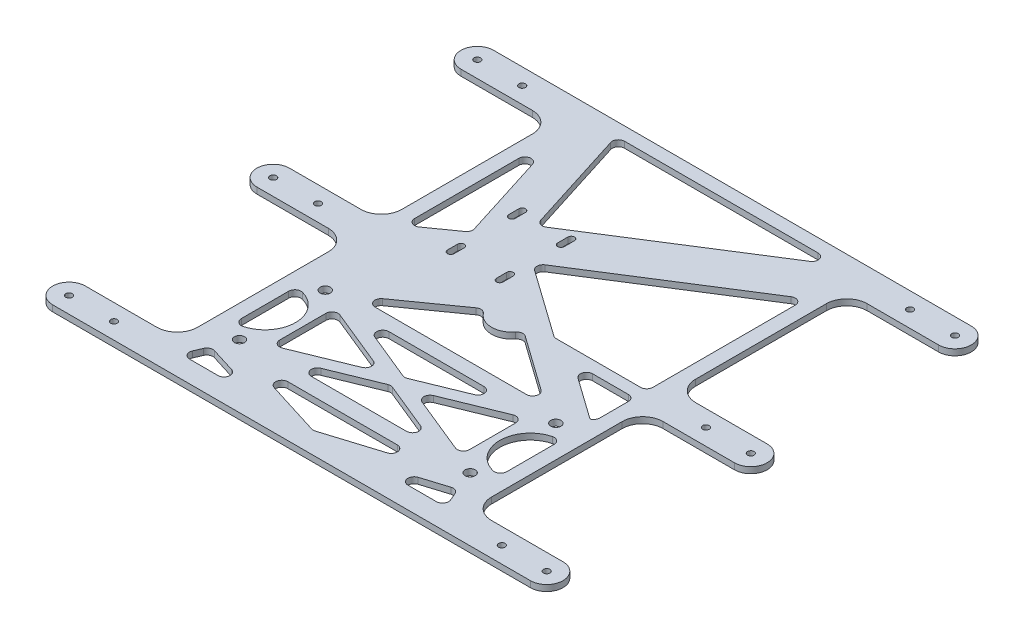
from build123d import *

# Parameters (mm, degrees)
SKETCH_1_W          = 144
SKETCH_1_H          = 16
SKETCH_1_H_2        = 84
SKETCH_1_R          = 1.6
EXTRUDE_1_DEPTH     = 3
FILLET_1_R          = 10
SKETCH_2_R          = 1.6
CUT_EXTRUDE_1_DEPTH = 166.221064032
SKETCH_4_R          = 2.5
CUT_EXTRUDE_2_DEPTH = 166.221064032
CUT_EXTRUDE_4_DEPTH = 10
SKETCH_6_R          = 10
EXTRUDE_2_DEPTH     = 3
CUT_EXTRUDE_6_DEPTH = 166.221064032
FILLET_2_R          = 3


with BuildPart() as part:
    # 草图1 → 凸台-拉伸1 (new body)
    # profile 1 of 13: a face of its own
    with BuildSketch(Plane(origin=(0, 0, 0), x_dir=(1, 0, 0), z_dir=(0, 1, 0))):
        Rectangle(SKETCH_1_W, SKETCH_1_H)
    # profile 2 of 13: a face of its own
    with BuildSketch(Plane(origin=(0, 0, 0), x_dir=(1, 0, 0), z_dir=(0, 1, 0))):
        with Locations((0, -50)):
            Rectangle(SKETCH_1_W, SKETCH_1_H_2)
    # profile 3 of 13: a face of its own
    with BuildSketch(Plane(origin=(0, 0, 0), x_dir=(1, 0, 0), z_dir=(0, 1, 0))):
        with Locations((0, 50)):
            Rectangle(SKETCH_1_W, SKETCH_1_H_2)
    # profile 4 of 13: a face of its own
    with BuildSketch(Plane(origin=(0, 0, 0), x_dir=(1, 0, 0), z_dir=(0, 1, 0))):
        with BuildLine():
            Line((-72, 8), (-95, 8))
            ThreePointArc((-95, 8), (-87, 0), (-95, -8))
            Line((-95, -8), (-72, -8))
            Line((-72, -8), (-72, 8))
        make_face()
    # profile 5 of 13: a face of its own
    with BuildSketch(Plane(origin=(0, 0, 0), x_dir=(1, 0, 0), z_dir=(0, 1, 0))):
        with BuildLine():
            Line((-117, -8), (-95, -8))
            ThreePointArc((-95, -8), (-87, 0), (-95, 8))
            Line((-95, 8), (-117, 8))
            ThreePointArc((-117, 8), (-125, 0), (-117, -8))
        make_face()
        with Locations(Location((-117, 0, 0), (0, 0, 270))):
            Circle(SKETCH_1_R, mode=Mode.SUBTRACT)
        with Locations(Location((-95, 0, 0), (0, 0, 270))):
            Circle(SKETCH_1_R, mode=Mode.SUBTRACT)
    # profile 6 of 13: a face of its own
    with BuildSketch(Plane(origin=(0, 0, 0), x_dir=(1, 0, 0), z_dir=(0, 1, 0))):
        with BuildLine():
            ThreePointArc((-95, -92), (-87, -100), (-95, -108))
            Line((-95, -108), (-117, -108))
            ThreePointArc((-117, -108), (-125, -100), (-117, -92))
            Line((-117, -92), (-95, -92))
        make_face()
        with Locations(Location((-95, -100, 0), (0, 0, 270))):
            Circle(SKETCH_1_R, mode=Mode.SUBTRACT)
        with Locations(Location((-117, -100, 0), (0, 0, 270))):
            Circle(SKETCH_1_R, mode=Mode.SUBTRACT)
    # profile 7 of 13: a face of its own
    with BuildSketch(Plane(origin=(0, 0, 0), x_dir=(1, 0, 0), z_dir=(0, 1, 0))):
        with BuildLine():
            ThreePointArc((95, -92), (87, -100), (95, -108))
            Line((95, -108), (-95, -108))
            ThreePointArc((-95, -108), (-87, -100), (-95, -92))
            Line((-95, -92), (95, -92))
        make_face()
    # profile 8 of 13: a face of its own
    with BuildSketch(Plane(origin=(0, 0, 0), x_dir=(1, 0, 0), z_dir=(0, 1, 0))):
        with BuildLine():
            Line((117, -92), (95, -92))
            ThreePointArc((95, -92), (87, -100), (95, -108))
            Line((95, -108), (117, -108))
            ThreePointArc((117, -108), (125, -100), (117, -92))
        make_face()
        with Locations(Location((117, -100, 0), (0, 0, 270))):
            Circle(SKETCH_1_R, mode=Mode.SUBTRACT)
        with Locations(Location((95, -100, 0), (0, 0, 270))):
            Circle(SKETCH_1_R, mode=Mode.SUBTRACT)
    # profile 9 of 13: a face of its own
    with BuildSketch(Plane(origin=(0, 0, 0), x_dir=(1, 0, 0), z_dir=(0, 1, 0))):
        with BuildLine():
            ThreePointArc((95, 92), (87, 100), (95, 108))
            Line((95, 108), (117, 108))
            ThreePointArc((117, 108), (125, 100), (117, 92))
            Line((117, 92), (95, 92))
        make_face()
        with Locations(Location((95, 100, 0), (0, 0, 270))):
            Circle(SKETCH_1_R, mode=Mode.SUBTRACT)
        with Locations(Location((117, 100, 0), (0, 0, 270))):
            Circle(SKETCH_1_R, mode=Mode.SUBTRACT)
    # profile 10 of 13: a face of its own
    with BuildSketch(Plane(origin=(0, 0, 0), x_dir=(1, 0, 0), z_dir=(0, 1, 0))):
        with BuildLine():
            ThreePointArc((95, -8), (87, 0), (95, 8))
            Line((95, 8), (117, 8))
            ThreePointArc((117, 8), (125, 0), (117, -8))
            Line((117, -8), (95, -8))
        make_face()
        with Locations(Location((95, 0, 0), (0, 0, 270))):
            Circle(SKETCH_1_R, mode=Mode.SUBTRACT)
        with Locations(Location((117, 0, 0), (0, 0, 270))):
            Circle(SKETCH_1_R, mode=Mode.SUBTRACT)
    # profile 11 of 13: a face of its own
    with BuildSketch(Plane(origin=(0, 0, 0), x_dir=(1, 0, 0), z_dir=(0, 1, 0))):
        with BuildLine():
            Line((95, 8), (72, 8))
            Line((72, 8), (72, -8))
            Line((72, -8), (95, -8))
            ThreePointArc((95, -8), (87, 0), (95, 8))
        make_face()
    # profile 12 of 13: a face of its own
    with BuildSketch(Plane(origin=(0, 0, 0), x_dir=(1, 0, 0), z_dir=(0, 1, 0))):
        with BuildLine():
            Line((-95, 92), (95, 92))
            ThreePointArc((95, 92), (87, 100), (95, 108))
            Line((95, 108), (-95, 108))
            ThreePointArc((-95, 108), (-87, 100), (-95, 92))
        make_face()
    # profile 13 of 13: a face of its own
    with BuildSketch(Plane(origin=(0, 0, 0), x_dir=(1, 0, 0), z_dir=(0, 1, 0))):
        with BuildLine():
            Line((-117, 92), (-95, 92))
            ThreePointArc((-95, 92), (-87, 100), (-95, 108))
            Line((-95, 108), (-117, 108))
            ThreePointArc((-117, 108), (-125, 100), (-117, 92))
        make_face()
        with Locations(Location((-117, 100, 0), (0, 0, 270))):
            Circle(SKETCH_1_R, mode=Mode.SUBTRACT)
        with Locations(Location((-95, 100, 0), (0, 0, 270))):
            Circle(SKETCH_1_R, mode=Mode.SUBTRACT)
    extrude(amount=EXTRUDE_1_DEPTH)

    # 圆角1
    fillet_1_edges = [part.edges().sort_by_distance(p)[0] for p in [
        (72, 1.5, -92),
        (72, 1.5, -8),
        (72, 1.5, 8),
        (72, 1.5, 92),
        (-72, 1.5, 92),
        (-72, 1.5, 8),
        (-72, 1.5, -8),
        (-72, 1.5, -92),
    ]]
    fillet(fillet_1_edges, radius=FILLET_1_R)

    # 草图2 → 切除-拉伸1 (cut, through all)
    with BuildSketch(Plane(origin=(0, 3, 0), x_dir=(1, 0, 0), z_dir=(0, 1, 0))):
        with BuildLine():
            ThreePointArc((-40.4, 47), (-42, 45.4), (-43.6, 47))
            Line((-43.6, 47), (-43.6, 42))
            ThreePointArc((-43.6, 42), (-42, 43.6), (-40.4, 42))
            Line((-40.4, 42), (-40.4, 47))
        make_face()
        with Locations((-42, 47)):
            Circle(SKETCH_2_R)
        with Locations((-42, 42)):
            Circle(SKETCH_2_R)
        with Locations((-18, 42)):
            Circle(SKETCH_2_R)
        with BuildLine():
            ThreePointArc((-16.4, 47), (-18, 45.4), (-19.6, 47))
            Line((-19.6, 47), (-19.6, 42))
            ThreePointArc((-19.6, 42), (-18, 43.6), (-16.4, 42))
            Line((-16.4, 42), (-16.4, 47))
        make_face()
        with Locations((-18, 47)):
            Circle(SKETCH_2_R)
        with Locations((-18, 17)):
            Circle(SKETCH_2_R)
        with BuildLine():
            ThreePointArc((-16.4, 17), (-18, 15.4), (-19.6, 17))
            Line((-19.6, 17), (-19.6, 12))
            ThreePointArc((-19.6, 12), (-18, 13.6), (-16.4, 12))
            Line((-16.4, 12), (-16.4, 17))
        make_face()
        with Locations((-18, 12)):
            Circle(SKETCH_2_R)
        with Locations((-42, 12)):
            Circle(SKETCH_2_R)
        with BuildLine():
            ThreePointArc((-40.4, 17), (-42, 15.4), (-43.6, 17))
            Line((-43.6, 17), (-43.6, 12))
            ThreePointArc((-43.6, 12), (-42, 13.6), (-40.4, 12))
            Line((-40.4, 12), (-40.4, 17))
        make_face()
        with Locations((-42, 17)):
            Circle(SKETCH_2_R)
    extrude(amount=-CUT_EXTRUDE_1_DEPTH, mode=Mode.SUBTRACT)

    # 草图4 → 切除-拉伸2 (cut, through all)
    with BuildSketch(Plane(origin=(0, 3, 0), x_dir=(1, 0, 0), z_dir=(0, 1, 0))):
        with Locations(Location((-56.5, -35, 0), (0, 0, 270))):
            Circle(SKETCH_4_R)
        with Locations(Location((56.5, -35, 0), (0, 0, 270))):
            Circle(SKETCH_4_R)
        with Locations(Location((56.5, -77, 0), (0, 0, 270))):
            Circle(SKETCH_4_R)
        with Locations(Location((-56.5, -77, 0), (0, 0, 270))):
            Circle(SKETCH_4_R)
    extrude(amount=-CUT_EXTRUDE_2_DEPTH, mode=Mode.SUBTRACT)

    # 草图5 → 切除-拉伸4 (cut)
    with BuildSketch(Plane(origin=(0, 3, 0), x_dir=(1, 0, 0), z_dir=(0, 1, 0))):
        Polygon((45, 97.5), (-45, 97.5), (-30, 50), align=None)
        Polygon((-50, 27), (-65, 74.5), (-65, 16.35483871), align=None)
        Polygon((65, 5), (65, 74.5), (-10, 27), (21, 5), align=None)
        with BuildLine():
            ThreePointArc((-65, -71), (-50, -56), (-65, -41))
            Line((-65, -41), (-65, -71))
        make_face()
        Polygon((0, 3), (-46.5, -30), (46.5, -30), align=None)
        Polygon((65, -25), (65, -5), (35.090909091, -5), (63.272727273, -25), align=None)
        Polygon((-60.545967179, -87), (-65, -97.5), (-26.873553386, -97.5), align=None)
        Polygon((-7.931362411, -56), (-46.5, -40.240771738), (-46.5, -71.759228262), align=None)
        Polygon((38.568637589, -37), (-38.568637589, -37), (0, -52.759228262), align=None)
        Polygon((46.5, -71.759228262), (46.5, -40.240771738), (7.931362411, -56), align=None)
        with BuildLine():
            Line((65, -71), (65, -41))
            ThreePointArc((65, -41), (50, -56), (65, -71))
        make_face()
        Polygon((-46.5, -83), (0, -97.5), (46.5, -83), align=None)
        Polygon((38.568637589, -75), (0, -59.240771738), (-38.568637589, -75), align=None)
        Polygon((60.545967179, -87), (26.873553386, -97.5), (65, -97.5), align=None)
    extrude(amount=-CUT_EXTRUDE_4_DEPTH, mode=Mode.SUBTRACT)

    # 草图6 → 凸台-拉伸2 (add, through all)
    with BuildSketch(Plane(origin=(0, 3, 0), x_dir=(1, 0, 0), z_dir=(0, 1, 0))):
        Circle(SKETCH_6_R)
    extrude(amount=-EXTRUDE_2_DEPTH)

    # 草图8 → 切除-拉伸6 (cut, through all)
    # profile 1 of 3: a face of its own
    with BuildSketch(Plane(origin=(0, 3, 0), x_dir=(1, 0, 0), z_dir=(0, 1, 0))):
        Polygon((-65, 16.35483871), (-65, 11.449915404), (-45.307908139, 25.424948338), (-65, 87.78323923), (-65, 74.5), (-50, 27), align=None)
    # profile 2 of 3: a face of its own
    with BuildSketch(Plane(origin=(0, 3, 0), x_dir=(1, 0, 0), z_dir=(0, 1, 0))):
        Polygon((58.791697223, 101.5), (-50.45786502, 101.5), (-32.249604646, 43.840508816), align=None)
        Polygon((45, 97.5), (-30, 50), (-45, 97.5), align=None, mode=Mode.SUBTRACT)
    # profile 3 of 3: a face of its own
    with BuildSketch(Plane(origin=(0, 3, 0), x_dir=(1, 0, 0), z_dir=(0, 1, 0))):
        Polygon((-17.177652793, 27.188894806), (19.724880797, 1), (65, 1), (65, 5), (21, 5), (-10, 27), (65, 74.5), (65, 79.234741575), align=None)
    extrude(amount=-CUT_EXTRUDE_6_DEPTH, mode=Mode.SUBTRACT)

    # 圆角2
    # the kernel refuses this fillet: 3 mm, written as the material it adds along each edge
    with BuildSketch(Plane(origin=(0, 3, 52.759228262), x_dir=(-0.9257054315077341, 0, -0.3782452300784242), z_dir=(0, -1, 0))) as fillet_2_piece_1:
        with BuildLine():
            CenterArc((FILLET_2_R * 0.408602150538, FILLET_2_R), FILLET_2_R, 225.549939098, 44.450060902)
            Line((-FILLET_2_R * 0.291685177313, FILLET_2_R * 0.286138908154), (0, 0))
            Line((0, 0), (FILLET_2_R * 0.408602150538, 0))
        make_face()
    extrude(amount=3)
    with BuildSketch(Plane(origin=(-38.568637589, 3, 37), x_dir=(0.9257054315077324, 0, 0.3782452300784281), z_dir=(0, -1, 0)), Plane(origin=(38.568637589, 3, 37), x_dir=(-1, 0, 0), z_dir=(0, -1, 0)), Plane(origin=(-38.568637589, 3, 75), x_dir=(1, 0, 0), z_dir=(0, -1, 0))) as fillet_2_piece_2:
        with BuildLine():
            CenterArc((FILLET_2_R * 5.0911558914, -FILLET_2_R), FILLET_2_R, 90, 157.774969549)
            Line((FILLET_2_R * 4.71291066132, -FILLET_2_R * 1.92570543151), (0, 0))
            Line((0, 0), (FILLET_2_R * 5.0911558914, 0))
        make_face()
    extrude(amount=3)
    with BuildSketch(Plane(origin=(-46.5, 3, 71.759228262), x_dir=(0.9257054315077324, 0, -0.37824523007842814), z_dir=(0, -1, 0)), Plane(origin=(-46.5, 3, 40.240771738), x_dir=(0, 0, 1), z_dir=(0, -1, 0)), Plane(origin=(46.5, 3, 40.240771738), x_dir=(-0.9257054315077325, 0, 0.3782452300784279), z_dir=(0, -1, 0))) as fillet_2_piece_3:
        with BuildLine():
            CenterArc((FILLET_2_R * 1.48885939649, -FILLET_2_R), FILLET_2_R, 90, 112.225030451)
            Line((FILLET_2_R * 0.563153964978, -FILLET_2_R * 1.37824523008), (0, 0))
            Line((0, 0), (FILLET_2_R * 1.48885939649, 0))
        make_face()
    extrude(amount=3)
    with BuildSketch(Plane(origin=(-7.931362411, 3, 56), x_dir=(-0.9257054315077323, 0, 0.3782452300784284), z_dir=(0, -1, 0))) as fillet_2_piece_4:
        with BuildLine():
            CenterArc((FILLET_2_R * 2.44736842105, FILLET_2_R), FILLET_2_R, 134.450060902, 135.549939098)
            Line((FILLET_2_R * 1.7470810932, FILLET_2_R * 1.71386109185), (0, 0))
            Line((0, 0), (FILLET_2_R * 2.44736842105, 0))
        make_face()
    extrude(amount=3)
    with BuildSketch(Plane(origin=(46.5, 3, 30), x_dir=(-1, 0, 0), z_dir=(0, -1, 0))) as fillet_2_piece_5:
        with BuildLine():
            CenterArc((FILLET_2_R * 3.13696161898, FILLET_2_R), FILLET_2_R, 125.362461887, 144.637538113)
            Line((FILLET_2_R * 2.55821461304, FILLET_2_R * 1.81550714474), (0, 0))
            Line((0, 0), (FILLET_2_R * 3.13696161898, 0))
        make_face()
    extrude(amount=3)
    with BuildSketch(Plane(origin=(-46.5, 3, 30), x_dir=(1, 0, 0), z_dir=(0, -1, 0)), Plane(origin=(35.090909091, 3, 5), x_dir=(0.8155071447352176, 0, 0.5787470059411219), z_dir=(0, -1, 0))) as fillet_2_piece_6:
        with BuildLine():
            CenterArc((FILLET_2_R * 3.13696161898, -FILLET_2_R), FILLET_2_R, 90, 144.637538113)
            Line((FILLET_2_R * 2.55821461304, -FILLET_2_R * 1.81550714474), (0, 0))
            Line((0, 0), (FILLET_2_R * 3.13696161898, 0))
        make_face()
    extrude(amount=3)
    with BuildSketch(Plane(origin=(-9.323163252, 0, 3.616438437), x_dir=(-0.8155071447352384, 0, 0.5787470059410924), z_dir=(0, 1, 0))) as fillet_2_piece_7:
        with BuildLine():
            CenterArc((3.292103243, 3), FILLET_2_R, 182.44012109, 87.55987891)
            ThreePointArc((0.294823458, 2.872274177), (0.25162391, 1.42544027), (0, 0))
            Line((0, 0), (3.292103243, 0))
        make_face()
    extrude(amount=3)
    with BuildSketch(Plane(origin=(9.323163252, 0, 3.616438437), x_dir=(-0.4924521746173323, 0, 0.8703395060059382), z_dir=(0, 1, 0))) as fillet_2_piece_8:
        with BuildLine():
            CenterArc((3.320470383, 2.968572082), FILLET_2_R, 174.139421833, 87.55987891)
            Line((0.336150461, 3.274896431), (0, 0))
            ThreePointArc((0, 0), (1.443682775, 0.104759728), (2.88736555, 0))
        make_face()
    extrude(amount=3)
    with BuildSketch(Plane(origin=(65, 3, 97.5), x_dir=(-0.39051175639458663, 0, -0.9205979405351802), z_dir=(0, -1, 0)), Plane(origin=(-65, 3, 97.5), x_dir=(1, 0, 0), z_dir=(0, -1, 0))) as fillet_2_piece_9:
        with BuildLine():
            CenterArc((FILLET_2_R * 1.51044413111, -FILLET_2_R), FILLET_2_R, 90, 112.986346123)
            Line((FILLET_2_R * 0.589846190576, -FILLET_2_R * 1.39051175639), (0, 0))
            Line((0, 0), (FILLET_2_R * 1.51044413111, 0))
        make_face()
    extrude(amount=3)
    with BuildSketch(Plane(origin=(26.873553386, 3, 97.5), x_dir=(1, 0, 0), z_dir=(0, -1, 0)), Plane(origin=(46.5, 3, 83), x_dir=(-1, 0, 0), z_dir=(0, -1, 0)), Plane(origin=(-26.873553386, 3, 97.5), x_dir=(-0.954662453656525, 0, -0.2976904425380556), z_dir=(0, -1, 0))) as fillet_2_piece_10:
        with BuildLine():
            CenterArc((FILLET_2_R * 6.56609072495, -FILLET_2_R), FILLET_2_R, 90, 162.681061568)
            Line((FILLET_2_R * 6.26840028242, -FILLET_2_R * 1.95466245366), (0, 0))
            Line((0, 0), (FILLET_2_R * 6.56609072495, 0))
        make_face()
    extrude(amount=3)
    with BuildSketch(Plane(origin=(60.545967179, 3, 87), x_dir=(0.3905117563945838, 0, 0.9205979405351813), z_dir=(0, -1, 0)), Plane(origin=(-60.545967179, 3, 87), x_dir=(0.9546624536565245, 0, 0.2976904425380574), z_dir=(0, -1, 0))) as fillet_2_piece_11:
        with BuildLine():
            CenterArc((FILLET_2_R * 0.905673312773, FILLET_2_R), FILLET_2_R, 185.667407692, 84.332592308)
            Line((-FILLET_2_R * 0.0894385935473, FILLET_2_R * 0.901246296776), (0, 0))
            Line((0, 0), (FILLET_2_R * 0.905673312773, 0))
        make_face()
    extrude(amount=3)
    with BuildSketch(Plane(origin=(0, 3, 97.5), x_dir=(0.954662453656524, 0, -0.2976904425380585), z_dir=(0, -1, 0))) as fillet_2_piece_12:
        with BuildLine():
            CenterArc((FILLET_2_R * 0.311827956989, -FILLET_2_R), FILLET_2_R, 90, 34.637876863)
            Line((-FILLET_2_R * 0.256559819618, -FILLET_2_R * 0.177239199157), (0, 0))
            Line((0, 0), (FILLET_2_R * 0.311827956989, 0))
        make_face()
    extrude(amount=3)
    with BuildSketch(Plane(origin=(-46.5, 3, 83), x_dir=(1, 0, 0), z_dir=(0, -1, 0))) as fillet_2_piece_13:
        with BuildLine():
            CenterArc((FILLET_2_R * 6.56609072495, FILLET_2_R), FILLET_2_R, 107.318938432, 162.681061568)
            Line((FILLET_2_R * 6.26840028242, FILLET_2_R * 1.95466245366), (0, 0))
            Line((0, 0), (FILLET_2_R * 6.56609072495, 0))
        make_face()
    extrude(amount=3)
    with BuildSketch(Plane(origin=(65, 3, 5), x_dir=(-1, 0, 0), z_dir=(0, -1, 0))) as fillet_2_piece_14:
        with BuildLine():
            CenterArc((FILLET_2_R, -FILLET_2_R), FILLET_2_R, 90, 90)
            Line((0, -FILLET_2_R), (0, 0))
            Line((0, 0), (FILLET_2_R, 0))
        make_face()
    extrude(amount=3)
    with BuildSketch(Plane(origin=(65, 3, 25), x_dir=(-1, 0, 0), z_dir=(0, -1, 0)), Plane(origin=(65, 3, -1), x_dir=(-1, 0, 0), z_dir=(0, -1, 0))) as fillet_2_piece_15:
        with BuildLine():
            CenterArc((FILLET_2_R, FILLET_2_R), FILLET_2_R, 180, 90)
            Line((0, FILLET_2_R), (0, 0))
            Line((0, 0), (FILLET_2_R, 0))
        make_face()
    extrude(amount=3)
    with BuildSketch(Plane(origin=(63.272727273, 3, 25), x_dir=(1, 0, 0), z_dir=(0, -1, 0)), Plane(origin=(19.724880797, 3, -1), x_dir=(1, 0, 0), z_dir=(0, -1, 0))) as fillet_2_piece_16:
        with BuildLine():
            CenterArc((FILLET_2_R * 0.318779800795, -FILLET_2_R), FILLET_2_R, 90, 35.362461887)
            Line((-FILLET_2_R * 0.259967205146, -FILLET_2_R * 0.184492855265), (0, 0))
            Line((0, 0), (FILLET_2_R * 0.318779800795, 0))
        make_face()
    extrude(amount=3)
    with BuildSketch(Plane(origin=(0, 3, 59.240771738), x_dir=(-0.9257054315077354, 0, 0.3782452300784203), z_dir=(0, -1, 0))) as fillet_2_piece_17:
        with BuildLine():
            CenterArc((FILLET_2_R * 0.408602150538, -FILLET_2_R), FILLET_2_R, 90, 44.450060902)
            Line((-FILLET_2_R * 0.291685177313, -FILLET_2_R * 0.286138908154), (0, 0))
            Line((0, 0), (FILLET_2_R * 0.408602150538, 0))
        make_face()
    extrude(amount=3)
    with BuildSketch(Plane(origin=(38.568637589, 3, 75), x_dir=(-1, 0, 0), z_dir=(0, -1, 0))) as fillet_2_piece_18:
        with BuildLine():
            CenterArc((FILLET_2_R * 5.0911558914, FILLET_2_R), FILLET_2_R, 112.225030451, 157.774969549)
            Line((FILLET_2_R * 4.71291066132, FILLET_2_R * 1.92570543151), (0, 0))
            Line((0, 0), (FILLET_2_R * 5.0911558914, 0))
        make_face()
    extrude(amount=3)
    with BuildSketch(Plane(origin=(46.5, 3, 71.759228262), x_dir=(-0.925705431507732, 0, -0.37824523007842925), z_dir=(0, -1, 0))) as fillet_2_piece_19:
        with BuildLine():
            CenterArc((FILLET_2_R * 1.48885939649, FILLET_2_R), FILLET_2_R, 157.774969549, 112.225030451)
            Line((FILLET_2_R * 0.563153964978, FILLET_2_R * 1.37824523008), (0, 0))
            Line((0, 0), (FILLET_2_R * 1.48885939649, 0))
        make_face()
    extrude(amount=3)
    with BuildSketch(Plane(origin=(7.931362411, 3, 56), x_dir=(0.9257054315077324, 0, 0.37824523007842786), z_dir=(0, -1, 0))) as fillet_2_piece_20:
        with BuildLine():
            CenterArc((FILLET_2_R * 2.44736842105, -FILLET_2_R), FILLET_2_R, 90, 135.549939098)
            Line((FILLET_2_R * 1.7470810932, -FILLET_2_R * 1.71386109185), (0, 0))
            Line((0, 0), (FILLET_2_R * 2.44736842105, 0))
        make_face()
    extrude(amount=3)
    with BuildSketch(Plane(origin=(-50.45786502, 3, -101.5), x_dir=(0.3011313679370943, 0, 0.9535826651341427), z_dir=(0, -1, 0))) as fillet_2_piece_21:
        with BuildLine():
            CenterArc((FILLET_2_R * 1.36446625501, -FILLET_2_R), FILLET_2_R, 90, 107.525568374)
            Line((FILLET_2_R * 0.410883589875, -FILLET_2_R * 1.30113136794), (0, 0))
            Line((0, 0), (FILLET_2_R * 1.36446625501, 0))
        make_face()
    extrude(amount=3)
    with BuildSketch(Plane(origin=(58.791697223, 3, -101.5), x_dir=(-0.8448190755542284, 0, 0.5350520811843452), z_dir=(0, -1, 0))) as fillet_2_piece_22:
        with BuildLine():
            CenterArc((FILLET_2_R * 3.44792430574, FILLET_2_R), FILLET_2_R, 122.347443499, 147.652556501)
            Line((FILLET_2_R * 2.91287222456, FILLET_2_R * 1.84481907555), (0, 0))
            Line((0, 0), (FILLET_2_R * 3.44792430574, 0))
        make_face()
    extrude(amount=3)
    with BuildSketch(Plane(origin=(-32.249604646, 3, -43.840508816), x_dir=(0.844819075554229, 0, -0.5350520811843442), z_dir=(0, -1, 0))) as fillet_2_piece_23:
        with BuildLine():
            CenterArc((FILLET_2_R * 1.29903937363, -FILLET_2_R), FILLET_2_R, 90, 104.821875126)
            Line((FILLET_2_R * 0.332313582877, -FILLET_2_R * 1.25581486568), (0, 0))
            Line((0, 0), (FILLET_2_R * 1.29903937363, 0))
        make_face()
    extrude(amount=3)
    with BuildSketch(Plane(origin=(-45.307908139, 3, -25.424948338), x_dir=(-0.3011313679370963, 0, -0.953582665134142), z_dir=(0, -1, 0))) as fillet_2_piece_24:
        with BuildLine():
            CenterArc((FILLET_2_R * 0.728719500608, -FILLET_2_R), FILLET_2_R, 90, 72.163106487)
            Line((-FILLET_2_R * 0.223212853493, -FILLET_2_R * 0.693691669693), (0, 0))
            Line((0, 0), (FILLET_2_R * 0.728719500608, 0))
        make_face()
    extrude(amount=3)
    with BuildSketch(Plane(origin=(-17.177652793, 3, -27.188894806), x_dir=(0.8155071447352177, 0, 0.5787470059411219), z_dir=(0, -1, 0))) as fillet_2_piece_25:
        with BuildLine():
            CenterArc((FILLET_2_R * 1.49068735958, -FILLET_2_R), FILLET_2_R, 90, 112.290094613)
            Line((FILLET_2_R * 0.56541205403, -FILLET_2_R * 1.37929620212), (0, 0))
            Line((0, 0), (FILLET_2_R * 1.49068735958, 0))
        make_face()
    extrude(amount=3)
    with BuildSketch(Plane(origin=(65, 3, 41), x_dir=(-0.9920296962671679, 0, 0.12600429248271933), z_dir=(0, -1, 0)), Plane(origin=(-65, 3, 71), x_dir=(0.9920296962671665, 0, -0.12600429248272957), z_dir=(0, -1, 0))) as fillet_2_piece_26:
        with BuildLine():
            CenterArc((3.402115897, -2.976089089), FILLET_2_R, 82.761243907, 104.477512186)
            Line((0.426026808, -3.354101966), (0, 0))
            ThreePointArc((0, 0), (1.890064387, 0.119554556), (3.780128774, 0))
        make_face()
    extrude(amount=3)
    with BuildSketch(Plane(origin=(65, 3, 71), x_dir=(-0.9920296962671671, 0, -0.1260042924827251), z_dir=(0, -1, 0)), Plane(origin=(-65, 3, 41), x_dir=(0.9920296962671674, 0, 0.12600429248272332), z_dir=(0, -1, 0))) as fillet_2_piece_27:
        with BuildLine():
            CenterArc((3.402115897, 2.976089089), FILLET_2_R, 172.761243907, 104.477512186)
            Line((0.426026808, 3.354101966), (0, 0))
            ThreePointArc((0, 0), (1.890064387, -0.119554556), (3.780128774, 0))
        make_face()
    extrude(amount=3)
    with BuildSketch(Plane(origin=(-65, 3, -87.78323923), x_dir=(0.30113136793709827, 0, 0.9535826651341415), z_dir=(0, -1, 0))) as fillet_2_piece_28:
        with BuildLine():
            CenterArc((FILLET_2_R * 6.4874764742, FILLET_2_R), FILLET_2_R, 107.525568374, 162.474431626)
            Line((FILLET_2_R * 6.18634510626, FILLET_2_R * 1.95358266513), (0, 0))
            Line((0, 0), (FILLET_2_R * 6.4874764742, 0))
        make_face()
    extrude(amount=3)
    with BuildSketch(Plane(origin=(-65, 3, -11.449915404), x_dir=(0.8155071447352172, 0, -0.5787470059411222), z_dir=(0, -1, 0))) as fillet_2_piece_29:
        with BuildLine():
            CenterArc((FILLET_2_R * 1.93590824573, -FILLET_2_R), FILLET_2_R, 90, 125.362461887)
            Line((FILLET_2_R * 1.12040110099, -FILLET_2_R * 1.57874700594), (0, 0))
            Line((0, 0), (FILLET_2_R * 1.93590824573, 0))
        make_face()
    extrude(amount=3)
    with BuildSketch(Plane(origin=(65, 3, -79.234741575), x_dir=(-0.8448190755542306, 0, 0.5350520811843414), z_dir=(0, -1, 0))) as fillet_2_piece_30:
        with BuildLine():
            CenterArc((FILLET_2_R * 1.81701872697, -FILLET_2_R), FILLET_2_R, 90, 122.347443499)
            Line((FILLET_2_R * 0.972199651417, -FILLET_2_R * 1.53505208118), (0, 0))
            Line((0, 0), (FILLET_2_R * 1.81701872697, 0))
        make_face()
    extrude(amount=3)


solid = part.part
